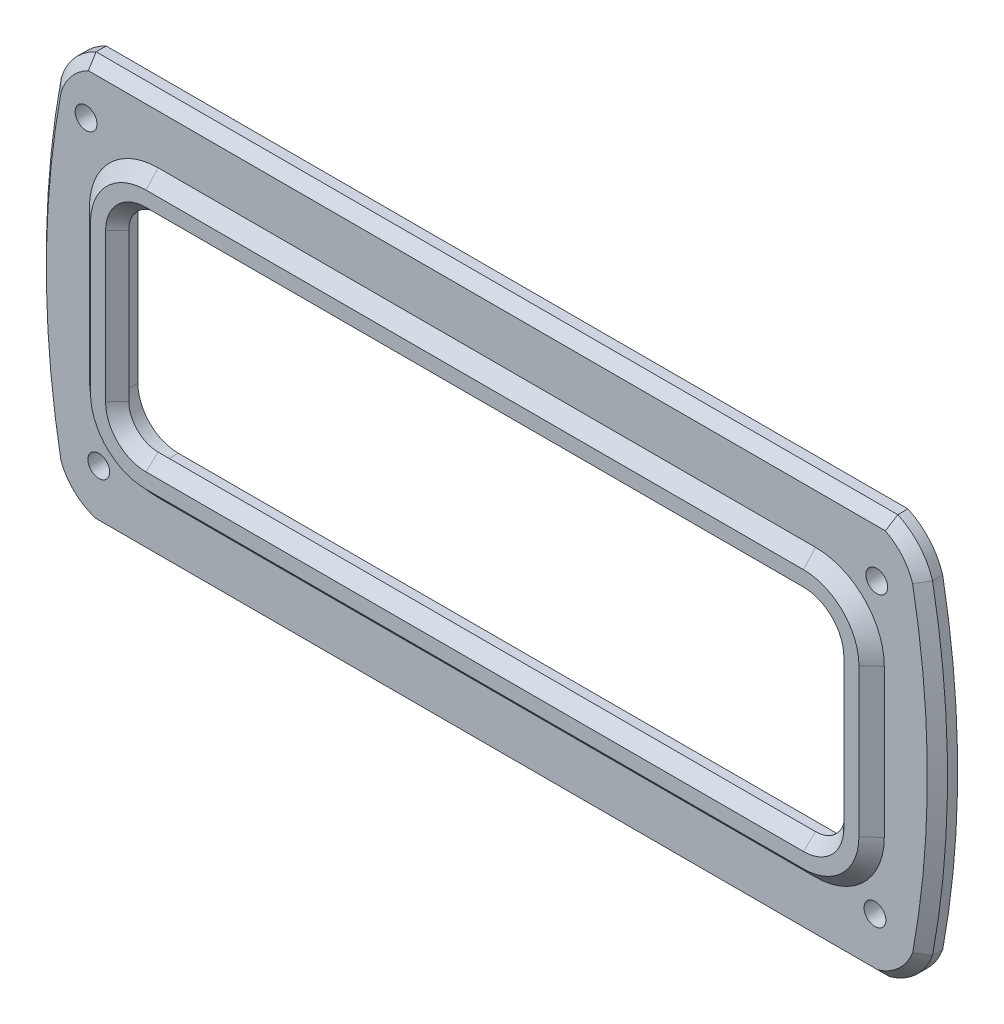
from build123d import *

# Parameters (mm, degrees)
BOSS_EXTRUDE1_DEPTH = 2.5
CHAMFER1_SIZE       = 1.25
SKETCH2_R           = 1.35
CUT_EXTRUDE1_DEPTH  = 62.140801434
BOSS_EXTRUDE2_DEPTH = 1.5
CHAMFER2_SIZE       = 1.5
CHAMFER2_SIZE_2     = 1.636962752


with BuildPart() as part:
    # Sketch1 → Boss-Extrude1 (new body)
    with BuildSketch(Plane.XY):
        with BuildLine():
            Line((49.586181166, 25), (-49.586181166, 25))
            ThreePointArc((-49.586181166, 25), (-52.267168909, 22.996486369), (-53.890165841, 20.069432712))
            ThreePointArc((-53.890165841, 20.069432712), (-55.74, 0), (-53.890165841, -20.069432712))
            ThreePointArc((-53.890165841, -20.069432712), (-51.813555608, -23.178667596), (-48.548222563, -25))
            Line((-48.548222563, -25), (48.548222563, -25))
            ThreePointArc((48.548222563, -25), (51.813555608, -23.178667596), (53.890165841, -20.069432712))
            ThreePointArc((53.890165841, -20.069432712), (55.74, 0), (53.890165841, 20.069432712))
            ThreePointArc((53.890165841, 20.069432712), (52.267168909, 22.996486369), (49.586181166, 25))
        make_face()
        with BuildLine():
            Line((-40.665, 14.165), (40.665, 14.165))
            ThreePointArc((40.665, 14.165), (44.200533906, 12.700533906), (45.665, 9.165))
            Line((45.665, 9.165), (45.665, -9.165))
            ThreePointArc((45.665, -9.165), (44.200533906, -12.700533906), (40.665, -14.165))
            Line((40.665, -14.165), (-40.665, -14.165))
            ThreePointArc((-40.665, -14.165), (-44.200533906, -12.700533906), (-45.665, -9.165))
            Line((-45.665, -9.165), (-45.665, 9.165))
            ThreePointArc((-45.665, 9.165), (-44.200533906, 12.700533906), (-40.665, 14.165))
        make_face(mode=Mode.SUBTRACT)
    extrude(amount=BOSS_EXTRUDE1_DEPTH)

    # Chamfer1
    chamfer1_edges = [part.edges().sort_by_distance(p)[0] for p in [
        (0, 25, 2.5),
    ]]
    chamfer(chamfer1_edges, length=CHAMFER1_SIZE)
    chamfer1_2_edges = [part.edges().sort_by_distance(p)[0] for p in [
        (-55.74, 0, 2.5),
    ]]
    chamfer(chamfer1_2_edges, length=CHAMFER1_SIZE)
    chamfer1_3_edges = [part.edges().sort_by_distance(p)[0] for p in [
        (0, -25, 2.5),
    ]]
    chamfer(chamfer1_3_edges, length=CHAMFER1_SIZE)
    chamfer1_4_edges = [part.edges().sort_by_distance(p)[0] for p in [
        (55.74, 0, 2.5),
    ]]
    chamfer(chamfer1_4_edges, length=CHAMFER1_SIZE)
    chamfer1_5_edges = [part.edges().sort_by_distance(p)[0] for p in [
        (51.737177521, 23.54787863, 2.5),
    ]]
    chamfer(chamfer1_5_edges, length=CHAMFER1_SIZE)
    chamfer1_6_edges = [part.edges().sort_by_distance(p)[0] for p in [
        (-51.737177521, 23.54787863, 2.5),
    ]]
    chamfer(chamfer1_6_edges, length=CHAMFER1_SIZE)
    chamfer1_7_edges = [part.edges().sort_by_distance(p)[0] for p in [
        (-51.5906008, -23.376861633, 2.5),
    ]]
    chamfer(chamfer1_7_edges, length=CHAMFER1_SIZE)
    chamfer1_8_edges = [part.edges().sort_by_distance(p)[0] for p in [
        (51.5906008, -23.376861633, 2.5),
    ]]
    chamfer(chamfer1_8_edges, length=CHAMFER1_SIZE)

    # Sketch2 → Cut-Extrude1 (cut, through all)
    with BuildSketch(Plane.XY.offset(2.5)):
        with Locations((-48.007044757, -17.939600751)):
            Circle(SKETCH2_R)
        with Locations((-49.574960594, 18.555541297)):
            Circle(SKETCH2_R)
        with Locations((48.233851408, 17.848510138)):
            Circle(SKETCH2_R)
        with Locations((48.007044757, -17.939600751)):
            Circle(SKETCH2_R)
    extrude(amount=-CUT_EXTRUDE1_DEPTH, mode=Mode.SUBTRACT)

    # Sketch3 → Boss-Extrude2 (add)
    with BuildSketch(Plane.XY.offset(2.5)):
        with BuildLine():
            Line((49.165, -9.165), (49.165, 9.165))
            ThreePointArc((49.165, 9.165), (46.67540764, 15.17540764), (40.665, 17.665))
            Line((40.665, 17.665), (-40.665, 17.665))
            ThreePointArc((-40.665, 17.665), (-46.67540764, 15.17540764), (-49.165, 9.165))
            Line((-49.165, 9.165), (-49.165, -9.165))
            ThreePointArc((-49.165, -9.165), (-46.67540764, -15.17540764), (-40.665, -17.665))
            Line((-40.665, -17.665), (40.665, -17.665))
            ThreePointArc((40.665, -17.665), (46.67540764, -15.17540764), (49.165, -9.165))
        make_face()
        with BuildLine():
            Line((44.165, -9.165), (44.165, 9.165))
            ThreePointArc((44.165, 9.165), (43.139873734, 11.639873734), (40.665, 12.665))
            Line((40.665, 12.665), (-40.665, 12.665))
            ThreePointArc((-40.665, 12.665), (-43.139873734, 11.639873734), (-44.165, 9.165))
            Line((-44.165, 9.165), (-44.165, -9.165))
            ThreePointArc((-44.165, -9.165), (-43.139873734, -11.639873734), (-40.665, -12.665))
            Line((-40.665, -12.665), (40.665, -12.665))
            ThreePointArc((40.665, -12.665), (43.139873734, -11.639873734), (44.165, -9.165))
        make_face(mode=Mode.SUBTRACT)
    extrude(amount=BOSS_EXTRUDE2_DEPTH)

    # Chamfer2
    # the kernel refuses this chamfer: 1.636962752, 1.5 mm, written as the material it takes off along each edge
    with BuildSketch(Plane(origin=(-40.665, 9.165, 4), x_dir=(0, 1, 0), z_dir=(1, 0, 0))) as chamfer2_piece_1:
        Polygon((3.5 + CHAMFER2_SIZE, 0), (3.5, -CHAMFER2_SIZE_2), (3.5, 0), align=None)
    revolve(axis=Axis((-40.665, 9.165, 4), (0, 0, 1)), revolution_arc=90, mode=Mode.SUBTRACT)
    with BuildSketch(Plane(origin=(-44.165, 9.165, 4), x_dir=(-0.9995117036729907, 0, 0.031246667353746753), z_dir=(0, -1, 0)), Plane(origin=(44.165, -9.165, 4), x_dir=(0.9995117036729907, 0, 0.031246667353746753), z_dir=(0, 1, 0))) as chamfer2_piece_2:
        Polygon((CHAMFER2_SIZE * 0.999511703673, CHAMFER2_SIZE * 0.0312466673537), (-CHAMFER2_SIZE_2 * 0.0312466673462, CHAMFER2_SIZE_2 * 0.999511703431), (0, 0), align=None)
    extrude(amount=18.33, mode=Mode.SUBTRACT)
    with BuildSketch(Plane(origin=(-40.665, -9.165, 4), x_dir=(-1, 0, 0), z_dir=(0, 1, 0))) as chamfer2_piece_3:
        Polygon((3.5 + CHAMFER2_SIZE, 0), (3.5, -CHAMFER2_SIZE_2), (3.5, 0), align=None)
    revolve(axis=Axis((-40.665, -9.165, 4), (0, 0, 1)), revolution_arc=90, mode=Mode.SUBTRACT)
    with BuildSketch(Plane(origin=(-40.665, -12.665, 4), x_dir=(0, -0.9995117036729907, 0.031246667353746788), z_dir=(1, 0, 0)), Plane(origin=(40.665, 12.665, 4), x_dir=(0, 0.9995117036729907, 0.031246667353746788), z_dir=(-1, 0, 0))) as chamfer2_piece_4:
        Polygon((CHAMFER2_SIZE * 0.999511703673, CHAMFER2_SIZE * 0.0312466673537), (-CHAMFER2_SIZE_2 * 0.0312466673462, CHAMFER2_SIZE_2 * 0.999511703431), (0, 0), align=None)
    extrude(amount=81.33, mode=Mode.SUBTRACT)
    with BuildSketch(Plane(origin=(40.665, -9.165, 4), x_dir=(0, -1, 0), z_dir=(-1, 0, 0))) as chamfer2_piece_5:
        Polygon((3.5 + CHAMFER2_SIZE, 0), (3.5, -CHAMFER2_SIZE_2), (3.5, 0), align=None)
    revolve(axis=Axis((40.665, -9.165, 4), (0, 0, 1)), revolution_arc=90, mode=Mode.SUBTRACT)
    with BuildSketch(Plane(origin=(40.665, 9.165, 4), x_dir=(1, 0, 0), z_dir=(0, -1, 0))) as chamfer2_piece_6:
        Polygon((3.5 + CHAMFER2_SIZE, 0), (3.5, -CHAMFER2_SIZE_2), (3.5, 0), align=None)
    revolve(axis=Axis((40.665, 9.165, 4), (0, 0, 1)), revolution_arc=90, mode=Mode.SUBTRACT)
    with BuildSketch(Plane(origin=(49.165, -9.165, 4), x_dir=(0.03124666735374564, 0, -0.9995117036729907), z_dir=(0, 1, 0))) as chamfer2_piece_7_section:
        Polygon((CHAMFER2_SIZE * 0.999511703673, CHAMFER2_SIZE * 0.0312466673537), (-CHAMFER2_SIZE_2 * 0.0312466673462, CHAMFER2_SIZE_2 * 0.999511703431), (0, 0), align=None)
    chamfer2_piece_7 = extrude(amount=18.33, mode=Mode.PRIVATE)
    chamfer2_piece_7 = split(chamfer2_piece_7, bisect_by=Plane(origin=(48.622856571, 0, 2.5), z_dir=(0, 0, 1)), keep=Keep.TOP, mode=Mode.PRIVATE)
    add(chamfer2_piece_7, mode=Mode.SUBTRACT)
    with BuildSketch(Plane(origin=(40.665, -9.165, 4), x_dir=(0, -1, 0), z_dir=(-1, 0, 0))) as chamfer2_piece_8_section:
        Polygon((8.5, -CHAMFER2_SIZE), (8.5 - CHAMFER2_SIZE_2, 0), (8.5, 0), align=None)
    chamfer2_piece_8 = revolve(axis=Axis((40.665, -9.165, 4), (0, 0, 1)), revolution_arc=90, mode=Mode.PRIVATE)
    chamfer2_piece_8 = split(chamfer2_piece_8, bisect_by=Plane(origin=(46.09185199, -14.59185199, 2.5), z_dir=(0, 0, 1)), keep=Keep.TOP, mode=Mode.PRIVATE)
    add(chamfer2_piece_8, mode=Mode.SUBTRACT)
    with BuildSketch(Plane(origin=(-40.665, -17.665, 4), x_dir=(0, -0.03124666735374564, -0.9995117036729907), z_dir=(1, 0, 0))) as chamfer2_piece_9_section:
        Polygon((CHAMFER2_SIZE * 0.999511703673, CHAMFER2_SIZE * 0.0312466673537), (-CHAMFER2_SIZE_2 * 0.0312466673462, CHAMFER2_SIZE_2 * 0.999511703431), (0, 0), align=None)
    chamfer2_piece_9 = extrude(amount=81.33, mode=Mode.PRIVATE)
    chamfer2_piece_9 = split(chamfer2_piece_9, bisect_by=Plane(origin=(0, -17.122856571, 2.5), z_dir=(0, 0, 1)), keep=Keep.TOP, mode=Mode.PRIVATE)
    add(chamfer2_piece_9, mode=Mode.SUBTRACT)
    with BuildSketch(Plane(origin=(-40.665, -9.165, 4), x_dir=(-1, 0, 0), z_dir=(0, 1, 0))) as chamfer2_piece_10_section:
        Polygon((8.5, -CHAMFER2_SIZE), (8.5 - CHAMFER2_SIZE_2, 0), (8.5, 0), align=None)
    chamfer2_piece_10 = revolve(axis=Axis((-40.665, -9.165, 4), (0, 0, 1)), revolution_arc=90, mode=Mode.PRIVATE)
    chamfer2_piece_10 = split(chamfer2_piece_10, bisect_by=Plane(origin=(-46.09185199, -14.59185199, 2.5), z_dir=(0, 0, 1)), keep=Keep.TOP, mode=Mode.PRIVATE)
    add(chamfer2_piece_10, mode=Mode.SUBTRACT)
    with BuildSketch(Plane(origin=(-49.165, 9.165, 4), x_dir=(-0.03124666735374564, 0, -0.9995117036729907), z_dir=(0, -1, 0))) as chamfer2_piece_11_section:
        Polygon((CHAMFER2_SIZE * 0.999511703673, CHAMFER2_SIZE * 0.0312466673537), (-CHAMFER2_SIZE_2 * 0.0312466673462, CHAMFER2_SIZE_2 * 0.999511703431), (0, 0), align=None)
    chamfer2_piece_11 = extrude(amount=18.33, mode=Mode.PRIVATE)
    chamfer2_piece_11 = split(chamfer2_piece_11, bisect_by=Plane(origin=(-48.622856571, 0, 2.5), z_dir=(0, 0, 1)), keep=Keep.TOP, mode=Mode.PRIVATE)
    add(chamfer2_piece_11, mode=Mode.SUBTRACT)
    with BuildSketch(Plane(origin=(-40.665, 9.165, 4), x_dir=(0, 1, 0), z_dir=(1, 0, 0))) as chamfer2_piece_12_section:
        Polygon((8.5, -CHAMFER2_SIZE), (8.5 - CHAMFER2_SIZE_2, 0), (8.5, 0), align=None)
    chamfer2_piece_12 = revolve(axis=Axis((-40.665, 9.165, 4), (0, 0, 1)), revolution_arc=90, mode=Mode.PRIVATE)
    chamfer2_piece_12 = split(chamfer2_piece_12, bisect_by=Plane(origin=(-46.09185199, 14.59185199, 2.5), z_dir=(0, 0, 1)), keep=Keep.TOP, mode=Mode.PRIVATE)
    add(chamfer2_piece_12, mode=Mode.SUBTRACT)
    with BuildSketch(Plane(origin=(40.665, 17.665, 4), x_dir=(0, 0.03124666735374564, -0.9995117036729907), z_dir=(-1, 0, 0))) as chamfer2_piece_13_section:
        Polygon((CHAMFER2_SIZE * 0.999511703673, CHAMFER2_SIZE * 0.0312466673537), (-CHAMFER2_SIZE_2 * 0.0312466673462, CHAMFER2_SIZE_2 * 0.999511703431), (0, 0), align=None)
    chamfer2_piece_13 = extrude(amount=81.33, mode=Mode.PRIVATE)
    chamfer2_piece_13 = split(chamfer2_piece_13, bisect_by=Plane(origin=(0, 17.122856571, 2.5), z_dir=(0, 0, 1)), keep=Keep.TOP, mode=Mode.PRIVATE)
    add(chamfer2_piece_13, mode=Mode.SUBTRACT)
    with BuildSketch(Plane(origin=(40.665, 9.165, 4), x_dir=(1, 0, 0), z_dir=(0, -1, 0))) as chamfer2_piece_14_section:
        Polygon((8.5, -CHAMFER2_SIZE), (8.5 - CHAMFER2_SIZE_2, 0), (8.5, 0), align=None)
    chamfer2_piece_14 = revolve(axis=Axis((40.665, 9.165, 4), (0, 0, 1)), revolution_arc=90, mode=Mode.PRIVATE)
    chamfer2_piece_14 = split(chamfer2_piece_14, bisect_by=Plane(origin=(46.09185199, 14.59185199, 2.5), z_dir=(0, 0, 1)), keep=Keep.TOP, mode=Mode.PRIVATE)
    add(chamfer2_piece_14, mode=Mode.SUBTRACT)


solid = part.part
